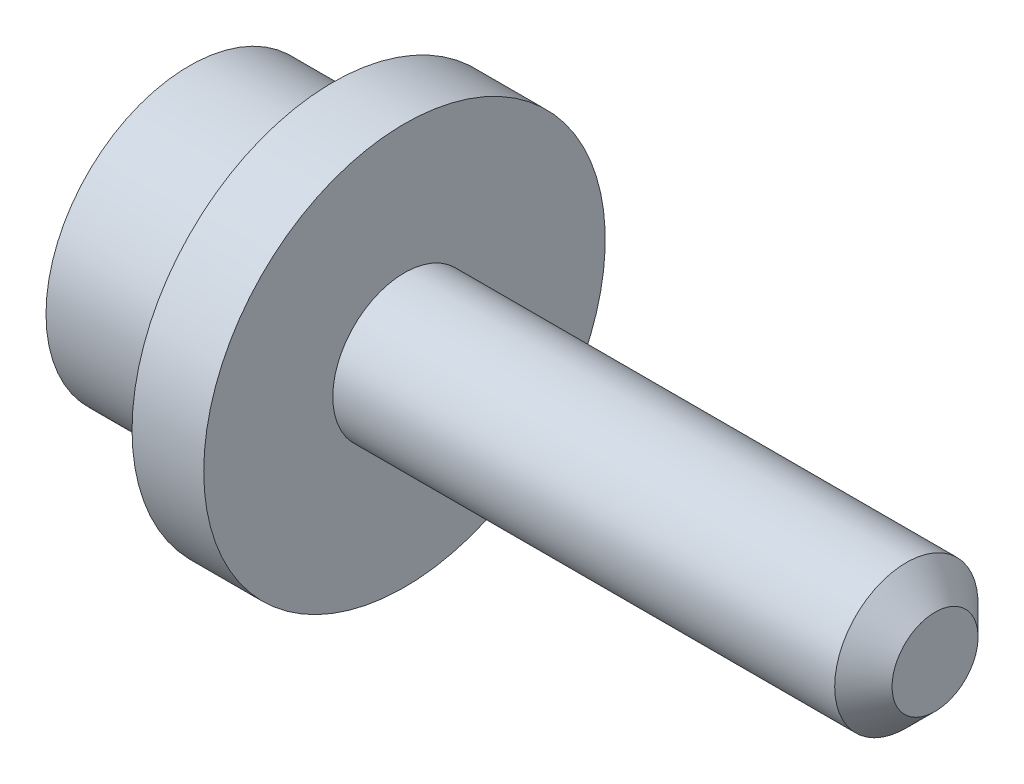
from build123d import *

# Parameters (mm, degrees)
CHANFREIN1_SIZE = 1


with BuildPart() as part:
    # Esquisse1 → Révolution1 (revolve)
    with BuildSketch(Plane.XY):
        Polygon((0, 1.5), (15, 1.5), (15, 0), (26, 0), (26, 2.5), (7.5, 2.5), (7.5, 7), (5, 7), (5, 5), (0, 5), align=None)
    revolve(axis=Axis((-19.163170338, 0, 0), (1, 0, 0)))

    # Chanfrein1
    chanfrein1_edges = [part.edges().sort_by_distance(p)[0] for p in [
        (26, -2.5, 0),
    ]]
    chamfer(chanfrein1_edges, length=CHANFREIN1_SIZE)


solid = part.part
